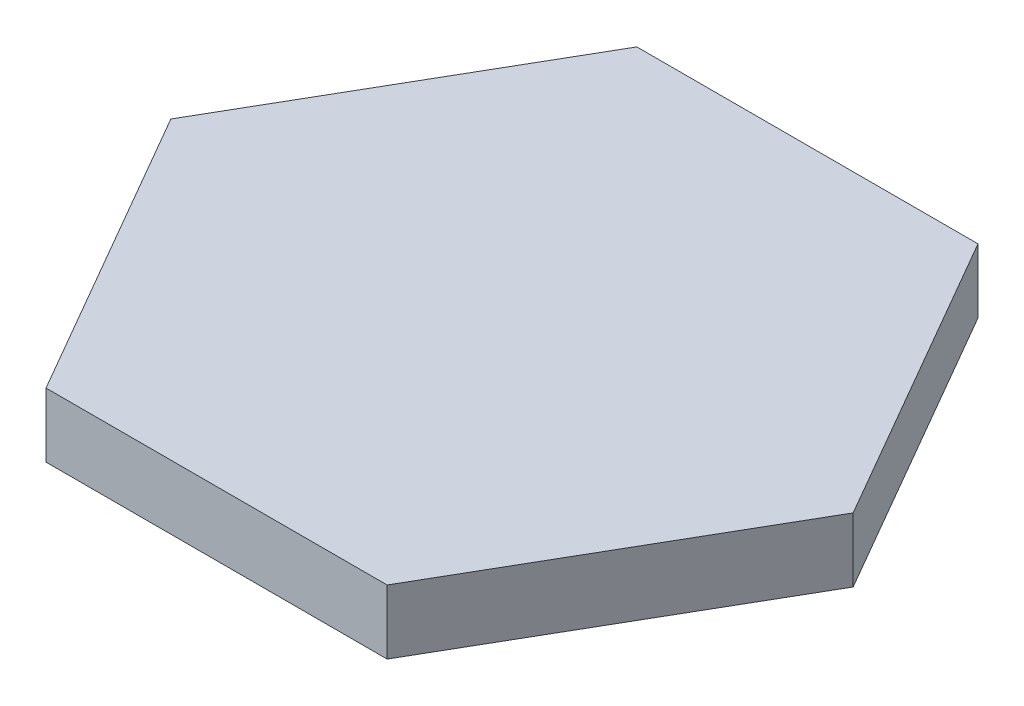
from build123d import *

# Parameters (mm, degrees)
BOSS_EXTRUDE1_DEPTH = 5.08


with BuildPart() as part:
    # Sketch1 → Boss-Extrude1 (new body)
    with BuildSketch(Plane(origin=(0, 0, 0), x_dir=(1, 0, 0), z_dir=(0, 1, 0))):
        Polygon((13.5, -23.382685902), (27, 0), (13.5, 23.382685902), (-13.5, 23.382685902), (-27, 0), (-13.5, -23.382685902), align=None)
    extrude(amount=BOSS_EXTRUDE1_DEPTH)


solid = part.part
